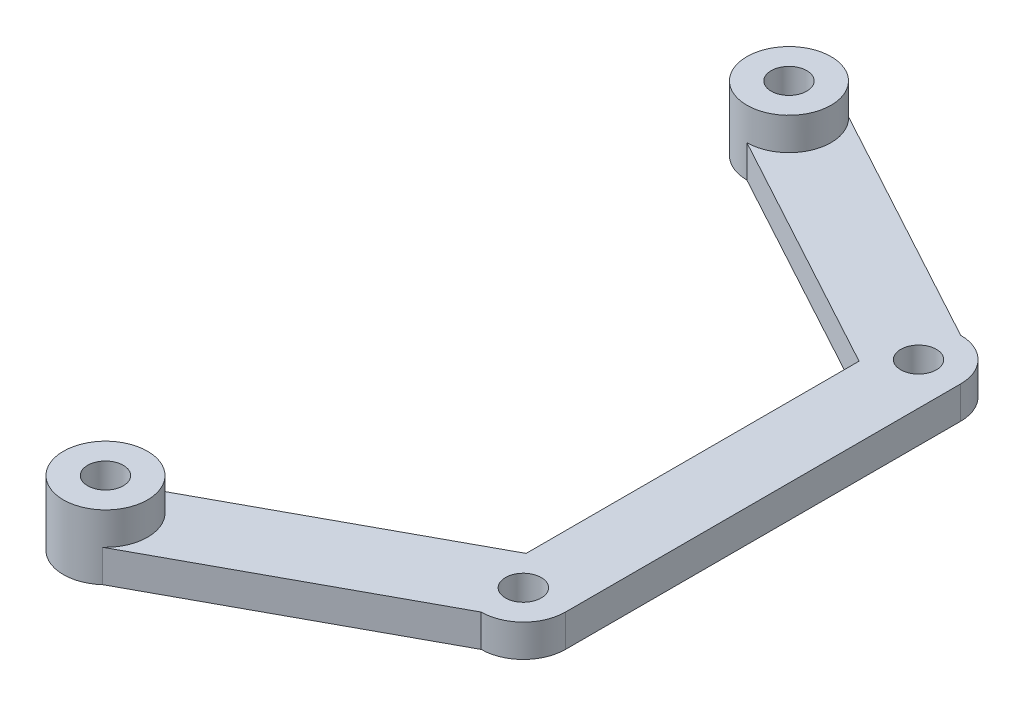
from build123d import *

# Parameters (mm, degrees)
SKETCH3_R           = 1.375
BOSS_EXTRUDE1_DEPTH = 2.5
SKETCH4_R           = 3.25
SKETCH4_R_2         = 1.375
BOSS_EXTRUDE2_DEPTH = 2.5


with BuildPart() as part:
    # Sketch3 → Boss-Extrude1 (new body)
    with BuildSketch(Plane(origin=(0, 0, 0), x_dir=(1, 0, 0), z_dir=(0, 1, 0))):
        with BuildLine():
            Line((-36.375, 23.125), (-17.438727612, 12.847507244))
            Line((-17.438727612, 12.847507244), (-17.438727612, -12.847507244))
            Line((-17.438727612, -12.847507244), (-36.375, -23.125))
            ThreePointArc((-36.375, -23.125), (-39.405726106, -27.548541338), (-34.186272388, -28.777492756))
            Line((-34.186272388, -28.777492756), (-15.25, -18.5))
            ThreePointArc((-15.25, -18.5), (-12.951902961, -17.548097039), (-12, -15.25))
            Line((-12, -15.25), (-12, 15.25))
            ThreePointArc((-12, 15.25), (-12.951902961, 17.548097039), (-15.25, 18.5))
            Line((-15.25, 18.5), (-34.186272388, 28.777492756))
            ThreePointArc((-34.186272388, 28.777492756), (-39.405726106, 27.548541338), (-36.375, 23.125))
        make_face()
        with Locations((-36.375, 26.375)):
            Circle(SKETCH3_R, mode=Mode.SUBTRACT)
        with Locations((-15.25, 15.25)):
            Circle(SKETCH3_R, mode=Mode.SUBTRACT)
        with Locations((-15.25, -15.25)):
            Circle(SKETCH3_R, mode=Mode.SUBTRACT)
        with Locations((-36.375, -26.375)):
            Circle(SKETCH3_R, mode=Mode.SUBTRACT)
    extrude(amount=BOSS_EXTRUDE1_DEPTH)

    # Sketch4 → Boss-Extrude2 (add)
    # profile 1 of 2: a face of its own
    with BuildSketch(Plane(origin=(0, 2.5, 0), x_dir=(1, 0, 0), z_dir=(0, 1, 0))):
        with Locations((-36.375, 26.375)):
            Circle(SKETCH4_R)
        with Locations((-36.375, 26.375)):
            Circle(SKETCH4_R_2, mode=Mode.SUBTRACT)
    # profile 2 of 2: a face of its own
    with BuildSketch(Plane(origin=(0, 2.5, 0), x_dir=(1, 0, 0), z_dir=(0, 1, 0))):
        with Locations((-36.375, -26.375)):
            Circle(SKETCH4_R)
        with Locations((-36.375, -26.375)):
            Circle(SKETCH4_R_2, mode=Mode.SUBTRACT)
    extrude(amount=BOSS_EXTRUDE2_DEPTH)


solid = part.part
